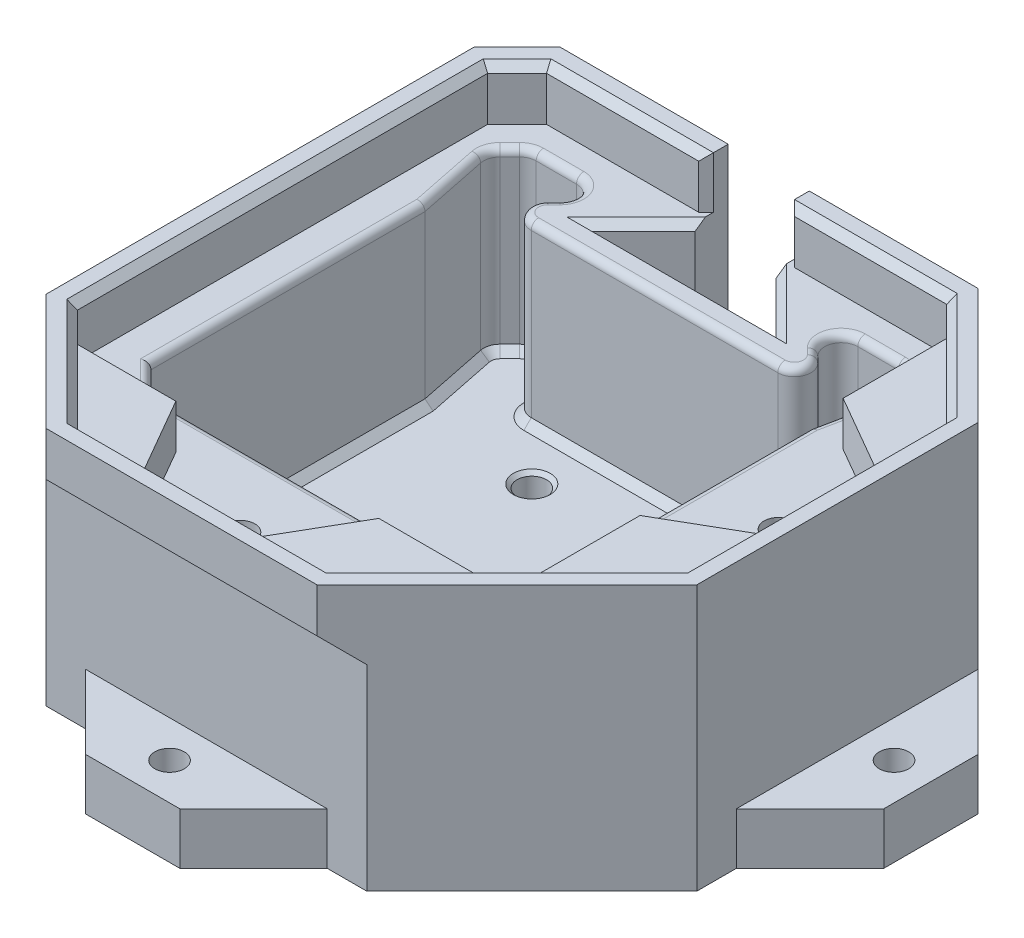
from build123d import *

# Parameters (mm, degrees)
BOSS_EXTRUDE1_DEPTH      = 6
BOSS_EXTRUDE1_DEPTH_BACK = 29
CUT_EXTRUDE1_DEPTH       = 6
CUT_EXTRUDE2_DEPTH       = 69.327816198
CUT_EXTRUDE2_DEPTH_BACK  = 69.327816198
SKETCH5_R                = 1.95
CUT_EXTRUDE3_DEPTH       = 12
SKETCH6_W                = 62.3
SKETCH6_H                = 63.674798272
CUT_EXTRUDE4_DEPTH       = 6
CUT_EXTRUDE5_DEPTH       = 24
BOSS_EXTRUDE2_DEPTH      = 36
CHAMFER1_SIZE            = 1
FILLET2_R                = 2.25
FILLET1_R                = 1
CHAMFER3_SIZE            = 1
CHAMFER5_SIZE            = 1
SKETCH10_R               = 2
CUT_EXTRUDE6_DEPTH       = 71.14709446
CHAMFER7_SIZE            = 0.5
SKETCH12_R               = 2
BOSS_EXTRUDE3_DEPTH      = 7
CUT_EXTRUDE7_DEPTH       = 20
SKETCH13_R               = 2
BOSS_EXTRUDE4_DEPTH      = 7
CHAMFER8_SIZE            = 10
CUT_EXTRUDE8_DEPTH       = 4


# Some blends are built 0.0001 mm under size
with BuildPart() as part:
    # Sketch2 → Boss-Extrude1 (new, two sides: drawn at the far end of the back side and taken through both)
    with BuildSketch(Plane(origin=(0, 0, 0), x_dir=(1, 0, 0), z_dir=(0, 1, 0)).offset(-BOSS_EXTRUDE1_DEPTH_BACK)):
        Polygon((17.15, -41.837399136), (-17.15, -41.837399136), (-31.15, -27.837399136), (-31.15, 27.837399136), (-27.15, 31.837399136), (27.15, 31.837399136), (41.15, 17.837399136), (41.15, -17.837399136), align=None)
    extrude(amount=BOSS_EXTRUDE1_DEPTH + BOSS_EXTRUDE1_DEPTH_BACK)

    # Sketch3 → Cut-Extrude1 (cut)
    with BuildSketch(Plane(origin=(0, 6, 0), x_dir=(1, 0, 0), z_dir=(0, 1, 0))):
        Polygon((-8, -41.837399136), (-13.773502692, -31.837399136), (13.773502692, -31.837399136), (8, -41.837399136), align=None)
        Polygon((41.15, -8), (41.15, 8), (31.15, 13.773502692), (31.15, -13.773502692), align=None)
    extrude(amount=-CUT_EXTRUDE1_DEPTH, mode=Mode.SUBTRACT)

    # Sketch4 → Cut-Extrude2 (cut, two sides: drawn at the far end of the back side and taken through both)
    with BuildSketch(Plane(origin=(0, 6, 0), x_dir=(1, 0, 0), z_dir=(0, 1, 0)).offset(-CUT_EXTRUDE2_DEPTH_BACK)):
        Polygon((-5.5, 31.837399136), (5.5, 31.837399136), (5.5, 30.337399136), (12.5, 23.337399136), (-12.5, 23.337399136), (-5.5, 30.337399136), align=None)
    extrude(amount=CUT_EXTRUDE2_DEPTH + CUT_EXTRUDE2_DEPTH_BACK, mode=Mode.SUBTRACT)

    # Sketch5 → Cut-Extrude3 (cut)
    with BuildSketch(Plane(origin=(0, 0, 0), x_dir=(1, 0, 0), z_dir=(0, 1, 0))):
        with Locations(Location((36.15, 0, 0), (0, 0, 270))):
            Circle(SKETCH5_R)
        with Locations(Location((0, -36.837399136, 0), (0, 0, 270))):
            Circle(SKETCH5_R)
    extrude(amount=-CUT_EXTRUDE3_DEPTH, mode=Mode.SUBTRACT)

    # Sketch6 → Cut-Extrude4 (cut)
    with BuildSketch(Plane(origin=(0, 6, 0), x_dir=(1, 0, 0), z_dir=(0, 1, 0))):
        Rectangle(SKETCH6_W, SKETCH6_H)
    extrude(amount=-CUT_EXTRUDE4_DEPTH, mode=Mode.SUBTRACT)

    # Sketch7 → Cut-Extrude5 (cut)
    with BuildSketch(Plane(origin=(0, 0, 0), x_dir=(1, 0, 0), z_dir=(0, 1, 0))):
        Polygon((-26.15, 14.337399136), (-26.15, -22.837399136), (-22.15, -26.837399136), (22.15, -26.837399136), (26.15, -22.837399136), (26.15, 14.337399136), (28.321572875, 25.008972011), (25.493145751, 27.837399136), (13.656854249, 27.837399136), (22.156854249, 19.337399136), (-22.156854249, 19.337399136), (-13.656854249, 27.837399136), (-25.493145751, 27.837399136), (-28.321572875, 25.008972011), align=None)
    extrude(amount=-CUT_EXTRUDE5_DEPTH, mode=Mode.SUBTRACT)

    # Sketch8 → Boss-Extrude2 (add)
    with BuildSketch(Plane.XZ.offset(29)):
        Polygon((28.392640687, -34.837399136), (44.15, -19.080039823), (44.15, 19.080039823), (18.392640687, 44.837399136), (-18.392640687, 44.837399136), (-34.15, 29.080039823), (-34.15, -29.080039823), (-28.392640687, -34.837399136), (-5.5, -34.837399136), (-5.5, -31.837399136), (-27.15, -31.837399136), (-31.15, -27.837399136), (-31.15, 27.837399136), (-17.15, 41.837399136), (17.15, 41.837399136), (41.15, 17.837399136), (41.15, -17.837399136), (27.15, -31.837399136), (5.5, -31.837399136), (5.5, -34.837399136), align=None)
    extrude(amount=-BOSS_EXTRUDE2_DEPTH)

    # Chamfer1
    chamfer1_edges = [part.edges().sort_by_distance(p)[0] for p in [
        (-16.325, 7, -31.837399136),
        (16.325, 7, -31.837399136),
        (34.15, 7, -24.837399136),
        (41.15, 7, 0),
        (29.15, 7, 29.837399136),
        (0, 7, 41.837399136),
        (-24.15, 7, 34.837399136),
        (-31.15, 7, 0),
        (-29.15, 7, -29.837399136),
    ]]
    chamfer(chamfer1_edges, length=CHAMFER1_SIZE - 0.0001)  # a hair under: the kernel refuses the full size

    # Fillet2
    fillet2_edges = [part.edges().sort_by_distance(p)[0] for p in [
        (-28.321572875, -12, -25.008972011),
        (-25.493145751, -12, -27.837399136),
        (-13.656854249, -12, -27.837399136),
        (-22.156854249, -12, -19.337399136),
        (22.156854249, -12, -19.337399136),
        (13.656854249, -12, -27.837399136),
        (25.493145751, -12, -27.837399136),
        (28.321572875, -12, -25.008972011),
    ]]
    fillet(fillet2_edges, radius=FILLET2_R)

    # Fillet1
    fillet1_edges = [part.edges().sort_by_distance(p)[0] for p in [
        (-26.15, 0, 4.25),
        (-24.15, 0, 24.837399136),
        (0, 0, 26.837399136),
        (24.15, 0, 24.837399136),
        (26.15, 0, 4.25),
        (27.115244011, 0, -19.080814346),
        (26.809410007, 0, -26.521134879),
        (21.825, 0, -27.837399136),
        (-27.115244011, 0, -19.080814346),
        (-26.809410007, 0, -26.521134879),
        (-21.825, 0, -27.837399136),
        (17.906854249, 0, -23.587399136),
        (-17.906854249, 0, -23.587399136),
        (0, 0, -19.337399136),
        (-18.803602682, 0, -20.726361413),
        (18.803602682, 0, -20.726361413),
        (28.030221986, 0, -24.921291305),
        (25.422202958, 0, -27.666128084),
        (-28.030221986, 0, -24.921291305),
        (-25.422202958, 0, -27.666128084),
        (17.010105817, 0, -26.448436858),
        (-17.010105817, 0, -26.448436858),
    ]]
    fillet(fillet1_edges, radius=FILLET1_R)

    # Chamfer3
    chamfer3_edges = [part.edges().sort_by_distance(p)[0] for p in [
        (-27.115244011, -24, -19.080814346),
        (26.15, -24, 4.25),
        (24.15, -24, 24.837399136),
        (0, -24, 26.837399136),
        (-24.15, -24, 24.837399136),
        (-26.15, -24, 4.25),
        (26.809410007, -24, -26.521134879),
        (27.115244011, -24, -19.080814346),
        (21.825, -24, -27.837399136),
        (17.906854249, -24, -23.587399136),
        (0, -24, -19.337399136),
        (-17.906854249, -24, -23.587399136),
        (-21.825, -24, -27.837399136),
        (-26.809410007, -24, -26.521134879),
        (-17.010105817, -24, -26.448436858),
        (17.010105817, -24, -26.448436858),
        (-25.422202958, -24, -27.666128084),
        (-28.030221986, -24, -24.921291305),
        (25.422202958, -24, -27.666128084),
        (28.030221986, -24, -24.921291305),
        (18.803602682, -24, -20.726361413),
        (-18.803602682, -24, -20.726361413),
    ]]
    chamfer(chamfer3_edges, length=CHAMFER3_SIZE)

    # Chamfer5
    chamfer5_edges = [part.edges().sort_by_distance(p)[0] for p in [
        (5.5, 3.00005, -31.837399136),
        (-5.5, 3.00005, -31.837399136),
        (9, 0, -26.837399136),
        (0, 0, -23.337399136),
        (-9, 0, -26.837399136),
    ]]
    chamfer(chamfer5_edges, length=CHAMFER5_SIZE)

    # Sketch10 → Cut-Extrude6 (cut, through all)
    with BuildSketch(Plane(origin=(0, -24, 0), x_dir=(1, 0, 0), z_dir=(0, 1, 0))):
        with Locations(Location((-9.899494937, 12.586894072, 0), (0, 0, 270))):
            Circle(SKETCH10_R)
        with Locations(Location((9.899494937, 12.586894072, 0), (0, 0, 270))):
            Circle(SKETCH10_R)
        with Locations(Location((-9.899494937, -7.212095801, 0), (0, 0, 270))):
            Circle(SKETCH10_R)
        with Locations(Location((9.899494937, -7.212095801, 0), (0, 0, 270))):
            Circle(SKETCH10_R)
    extrude(amount=-CUT_EXTRUDE6_DEPTH, mode=Mode.SUBTRACT)

    # Chamfer7
    chamfer7_edges = [part.edges().sort_by_distance(p)[0] for p in [
        (9.899494937, -24, -14.586894072),
        (-9.899494937, -24, 5.212095801),
        (9.899494937, -24, 5.212095801),
        (-9.899494937, -24, -14.586894072),
    ]]
    chamfer(chamfer7_edges, length=CHAMFER7_SIZE)

    # Sketch12 → Boss-Extrude3 (add)
    # profile 1 of 2: a face of its own
    with BuildSketch(Plane.XZ.offset(29)):
        Polygon((44.15, -19.080039823), (54.15, -9.080039823), (54.15, 3.705241552), (44.15, 13.705241552), align=None)
        with Locations(Location((49.15, -2.687399136, 0), (0, 0, 270))):
            Circle(SKETCH12_R, mode=Mode.SUBTRACT)
    # profile 2 of 2: a face of its own
    with BuildSketch(Plane.XZ.offset(29)):
        Polygon((-34.15, -19.080039823), (-44.15, -19.080039823), (-54.15, -9.080039823), (-54.15, 3.705241552), (-44.15, 13.705241552), (-34.15, 13.705241552), align=None)
        with Locations(Location((-49.15, -2.687399136, 0), (0, 0, 270))):
            Circle(SKETCH12_R, mode=Mode.SUBTRACT)
    extrude(amount=-BOSS_EXTRUDE3_DEPTH)

    # Sketch14 → Cut-Extrude7 (cut)
    with BuildSketch(Plane.XZ.offset(29)):
        Polygon((-16.392640687, 41.462600864), (16.392640687, 41.462600864), (21.767438958, 41.462600864), (18.392640687, 44.837399136), (-18.392640687, 44.837399136), (-21.767438958, 41.462600864), align=None)
    extrude(amount=-CUT_EXTRUDE7_DEPTH, mode=Mode.SUBTRACT)

    # Sketch13 → Boss-Extrude4 (add)
    with BuildSketch(Plane.XZ.offset(29)):
        Polygon((-6.392640687, 51.462600864), (6.392640687, 51.462600864), (16.392640687, 41.462600864), (-16.392640687, 41.462600864), align=None)
        with Locations(Location((0, 46.462600864, 0), (0, 0, 270))):
            Circle(SKETCH13_R, mode=Mode.SUBTRACT)
    extrude(amount=-BOSS_EXTRUDE4_DEPTH)

    # Chamfer8
    # the kernel refuses this chamfer: 10 mm, written as the material it takes off along each edge
    with BuildSketch(Plane(origin=(44.109470567, -9, 44.837399136), x_dir=(0, -0.027495876610586317, -0.9996219169112968), z_dir=(-1, 0, 0))) as chamfer8_piece_1_section:
        Polygon((CHAMFER8_SIZE * 0.999621916911, -CHAMFER8_SIZE * 0.0274958766106), (-CHAMFER8_SIZE * 0.0274958766106, -CHAMFER8_SIZE * 0.999621916911), (0, 0), align=None)
    chamfer8_piece_1 = extrude(amount=88.218941134, mode=Mode.PRIVATE)
    chamfer8_piece_1 = split(chamfer8_piece_1, bisect_by=Plane(origin=(0, -4.810052957, 41.462600864), z_dir=(0, 0, 1)), keep=Keep.TOP, mode=Mode.PRIVATE)
    add(chamfer8_piece_1, mode=Mode.SUBTRACT)

    # Sketch15 → Cut-Extrude8 (cut)
    with BuildSketch(Plane.XZ.offset(29)):
        Polygon((-45.7, -0.695540707), (-49.15, 1.296317722), (-52.6, -0.695540707), (-52.6, -4.679257564), (-49.15, -6.671115993), (-45.7, -4.679257564), align=None)
        Polygon((0, 50.446317722), (-3.45, 48.454459293), (-3.45, 44.470742436), (0, 42.478884007), (3.45, 44.470742436), (3.45, 48.454459293), align=None)
        Polygon((49.15, 1.296317722), (45.7, -0.695540707), (45.7, -4.679257564), (49.15, -6.671115993), (52.6, -4.679257564), (52.6, -0.695540707), align=None)
    extrude(amount=-CUT_EXTRUDE8_DEPTH, mode=Mode.SUBTRACT)


solid = part.part
